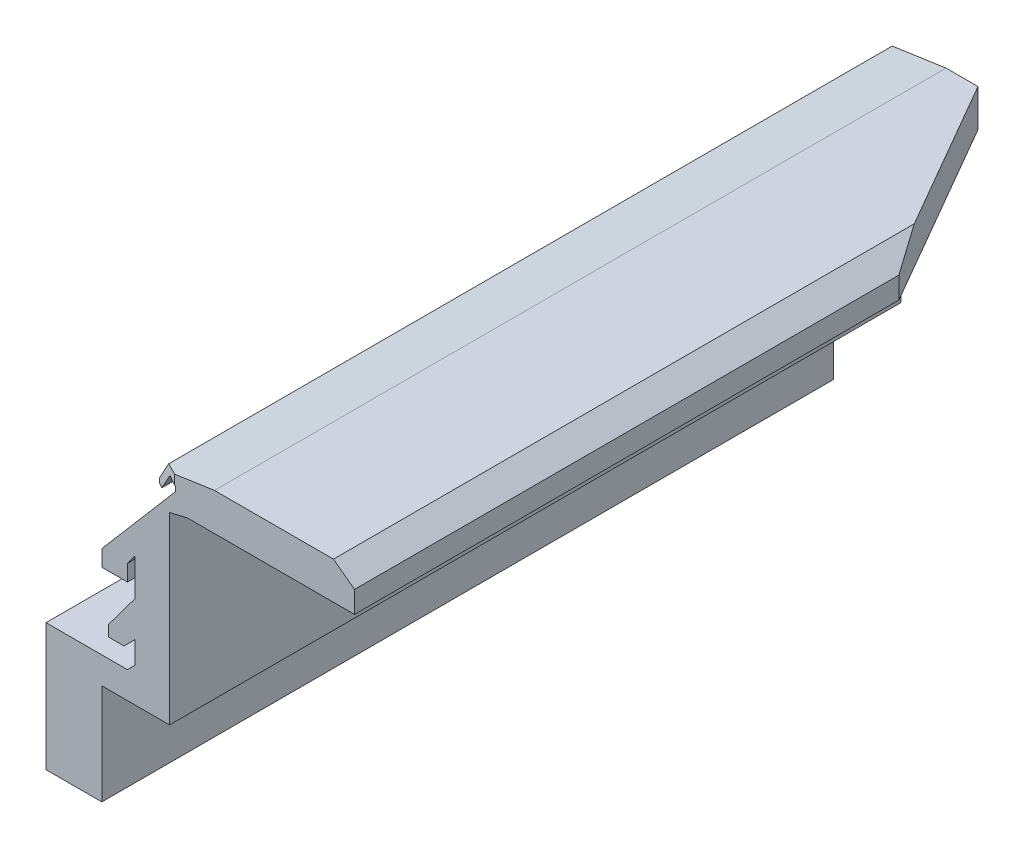
from build123d import *

# Parameters (mm, degrees)
EXTRUDE_1_DEPTH  = 88
CHAMFER_1_SIZE   = 13
CHAMFER_1_SIZE2  = 22.516660498
CHAMFER_2_SIZE   = 4.330127019
CHAMFER_2_SIZE_2 = 2.5


with BuildPart() as part:
    # Эскиз1 → Бобышка-Вытянуть1 (new body)
    with BuildSketch(Plane.XY.offset(1548)):
        Polygon((36.549287829, 66.569518917), (29.833037542, 66.569518917), (29.833037542, 81.891176087), (39.628851143, 81.891176087), (40.549825071, 82.812150015), (40.549825071, 85.491346897), (39.21022663, 84.151748456), (37.368278773, 84.151748456), (37.368278773, 85.491346897), (40.549825071, 89.761316928), (40.549825071, 94.198736764), (39.628851143, 92.962692808), (39.628851143, 91.017190466), (36.549287829, 91.017190466), (36.549287829, 92.962692808), (45.40586942, 103.324751144), (45.40586942, 103.910825462), (43.982546076, 103.910825462), (41.660685836, 100.794644613), (40.977578624, 100.794644613), (40.977578624, 101.303626458), (43.620510787, 104.850719623), (50.100205342, 105.797191861), (64.411422303, 105.797191861), (66.943124576, 103.910825462), (66.943124576, 101.303626458), (46.860358064, 101.303626458), (44.694207748, 100.794644613), (44.694207748, 78.667767338), (36.549287829, 78.667767338), align=None)
    extrude(amount=EXTRUDE_1_DEPTH)

    # Фаска1
    chamfer_1_edges = [part.edges().sort_by_distance(p)[0] for p in [
        (66.943124576, 102.60722596, 1548),
    ]]
    chamfer_1_side = [part.faces().sort_by_distance(p)[0] for p in [
        (43.066294454, 88.644441119, 1548),
    ]]
    chamfer(chamfer_1_edges, length=CHAMFER_1_SIZE, length2=CHAMFER_1_SIZE2, reference=chamfer_1_side[0])

    # Фаска2
    # the kernel refuses this chamfer: 4.330127019, 2.5 mm, written as the material it takes off along each edge
    with BuildSketch(Plane(origin=(40.977578624, 89.592234687, 1636), x_dir=(0.9998132206222081, 0, 0.01932676561269257), z_dir=(0, 1, 0))) as chamfer_2_piece_1_section:
        Polygon((CHAMFER_2_SIZE * 0.999813220604, CHAMFER_2_SIZE * 0.0193267656123), (-CHAMFER_2_SIZE_2 * 0.0193267656127, CHAMFER_2_SIZE_2 * 0.999813220622), (0, 0), align=None)
    chamfer_2_piece_1 = extrude(amount=22.913801697, mode=Mode.PRIVATE)
    chamfer_2_piece_1 = split(chamfer_2_piece_1, bisect_by=Plane(origin=(45.427089539, 103.349578342, 1635.744871049), z_dir=(-0.7601686994393885, 0.6497257485990753, 0)), keep=Keep.TOP, mode=Mode.PRIVATE)
    add(chamfer_2_piece_1, mode=Mode.SUBTRACT)


solid = part.part
